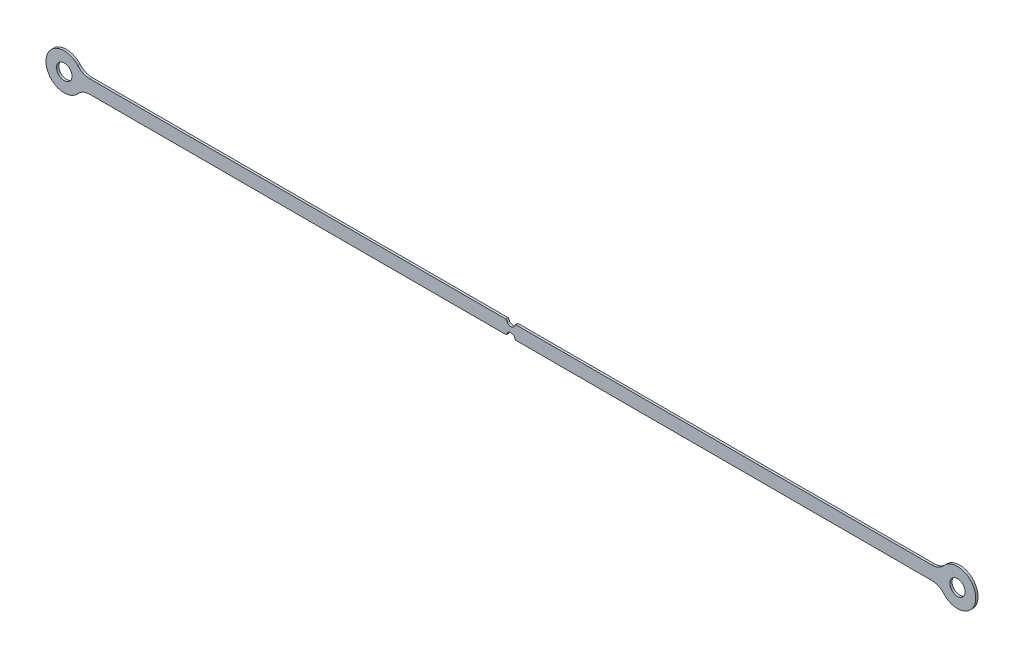
from build123d import *

# Parameters (mm, degrees)
SKETCH1_R           = 4
BOSS_EXTRUDE1_DEPTH = 1.2


with BuildPart() as part:
    # Sketch1 → Boss-Extrude1 (new body)
    with BuildSketch(Plane.XY):
        with BuildLine():
            ThreePointArc((2.111383352, 3.094339623), (0, 1.35), (-2.111383352, 3.094339623))
            ThreePointArc((-2.111383352, 3.094339623), (-2.283945369, 3.385467127), (-2.602402736, 3.5))
            Line((-2.602402736, 3.5), (-218.809094042, 3.5))
            ThreePointArc((-218.809094042, 3.5), (-222.121408727, 4.217928081), (-224.83922248, 6.242857143))
            ThreePointArc((-224.83922248, 6.242857143), (-241.5, 0), (-224.83922248, -6.242857143))
            ThreePointArc((-224.83922248, -6.242857143), (-222.121408727, -4.217928081), (-218.809094042, -3.5))
            Line((-218.809094042, -3.5), (-2.602402736, -3.5))
            ThreePointArc((-2.602402736, -3.5), (-2.283945369, -3.385467127), (-2.111383352, -3.094339623))
            ThreePointArc((-2.111383352, -3.094339623), (0, -1.35), (2.111383352, -3.094339623))
            ThreePointArc((2.111383352, -3.094339623), (2.283945369, -3.385467127), (2.602402736, -3.5))
            Line((2.602402736, -3.5), (218.809094042, -3.5))
            ThreePointArc((218.809094042, -3.5), (222.121408727, -4.217928081), (224.83922248, -6.242857143))
            ThreePointArc((224.83922248, -6.242857143), (241.5, 0), (224.83922248, 6.242857143))
            ThreePointArc((224.83922248, 6.242857143), (222.121408727, 4.217928081), (218.809094042, 3.5))
            Line((218.809094042, 3.5), (2.602402736, 3.5))
            ThreePointArc((2.602402736, 3.5), (2.283945369, 3.385467127), (2.111383352, 3.094339623))
        make_face()
        with Locations((232, 0)):
            Circle(SKETCH1_R, mode=Mode.SUBTRACT)
        with Locations((-232, 0)):
            Circle(SKETCH1_R, mode=Mode.SUBTRACT)
    extrude(amount=BOSS_EXTRUDE1_DEPTH)


solid = part.part
